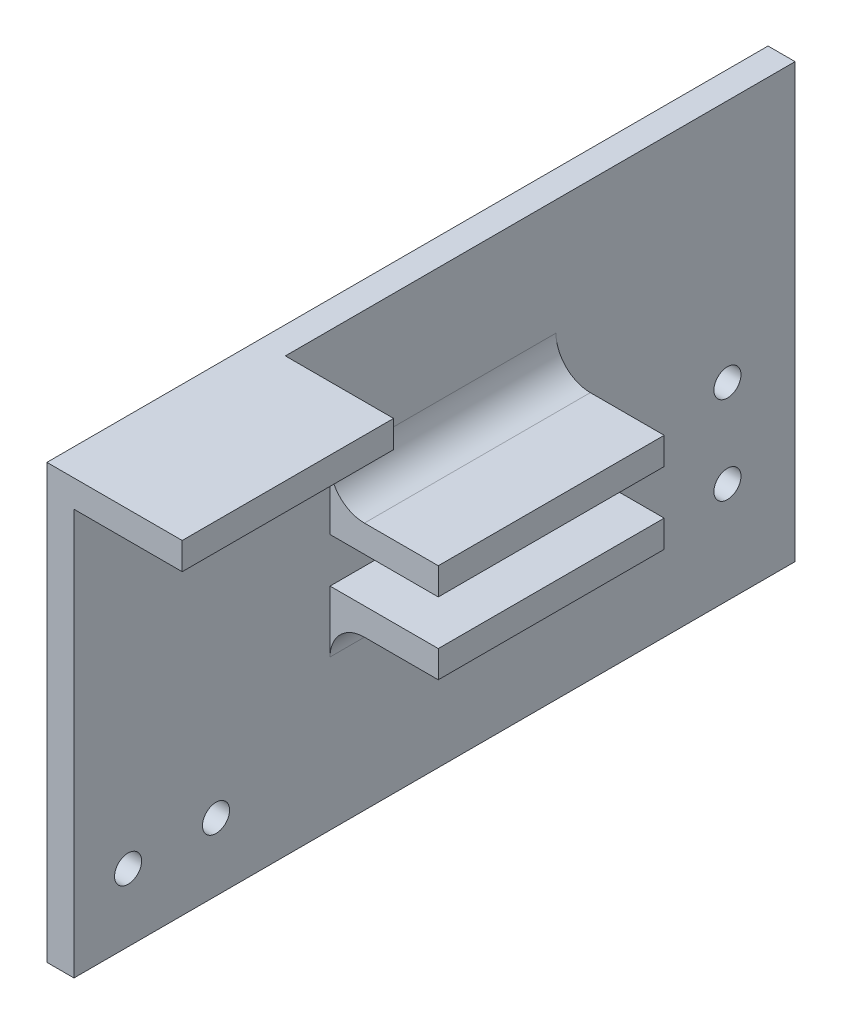
from build123d import *

# Parameters (mm, degrees)
SKETCH1_W           = 53.3
SKETCH1_H           = 32.007
SKETCH1_R           = 1
BOSS_EXTRUDE1_DEPTH = 2
SKETCH1_3_W         = 15.625
SKETCH1_3_H         = 2
SKETCH1_3_W_2       = 16.698
BOSS_EXTRUDE2_DEPTH = 10
FILLET1_R           = 2.54


with BuildPart() as part:
    # Sketch1 → Boss-Extrude1 (new body)
    with BuildSketch(Plane(origin=(0, 0, 0), x_dir=(0, 0, -1), z_dir=(1, 0, 0))):
        with Locations((26.65, -1.27147436)):
            Rectangle(SKETCH1_W, SKETCH1_H)
        with Locations((4, -12.27497436)):
            Circle(SKETCH1_R, mode=Mode.SUBTRACT)
        with Locations((10.5, -12.27497436)):
            Circle(SKETCH1_R, mode=Mode.SUBTRACT)
        with Locations((48.3, -9.8)):
            Circle(SKETCH1_R, mode=Mode.SUBTRACT)
        with Locations((48.3, -3.3)):
            Circle(SKETCH1_R, mode=Mode.SUBTRACT)
    extrude(amount=BOSS_EXTRUDE1_DEPTH)

    # Sketch1<3> → Boss-Extrude2 (add)
    with BuildSketch(Plane(origin=(0, 0, 0), x_dir=(0, 0, -1), z_dir=(1, 0, 0))):
        with Locations((7.8125, 13.73202564)):
            Rectangle(SKETCH1_3_W, SKETCH1_3_H)
        with Locations((27.276, 2.651)):
            Rectangle(SKETCH1_3_W_2, SKETCH1_3_H)
        with Locations((27.276, -2.651)):
            Rectangle(SKETCH1_3_W_2, SKETCH1_3_H)
    extrude(amount=BOSS_EXTRUDE2_DEPTH)

    # Fillet1
    fillet1_edges = [part.edges().sort_by_distance(p)[0] for p in [
        (2, 3.651, -27.276),
        (2, -3.651, -27.276),
    ]]
    fillet(fillet1_edges, radius=FILLET1_R)


solid = part.part
